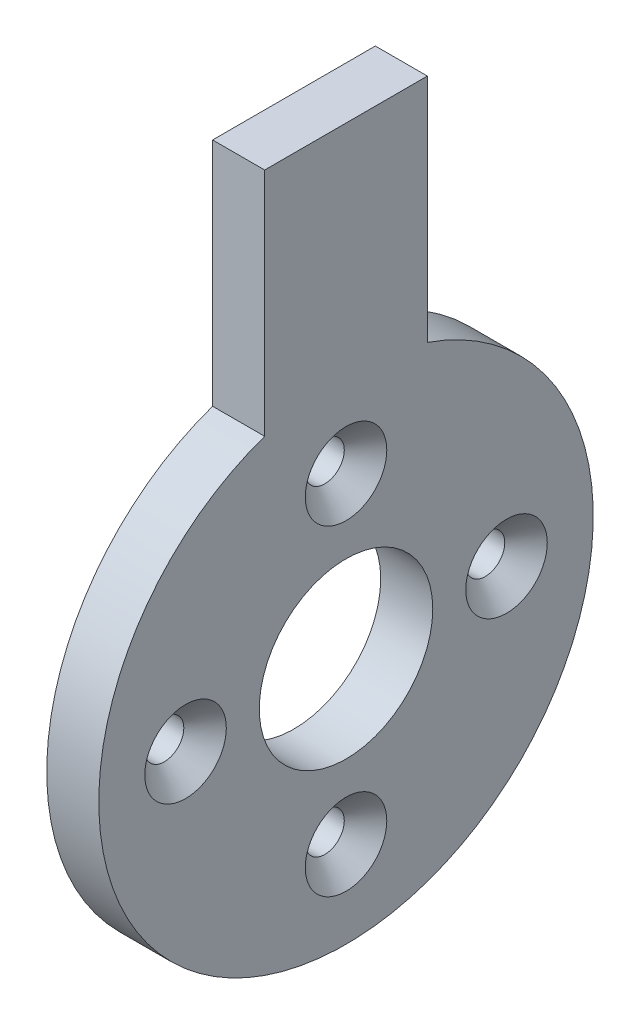
from build123d import *

# Parameters (mm, degrees)
SKETCH1_R                                       = 28.5
BOSS_EXTRUDE1_DEPTH                             = 3
SKETCH2_R                                       = 10
CUT_EXTRUDE1_DEPTH                              = 41.749233122
BOSS_EXTRUDE2_DEPTH                             = 3
CSK_FOR_M4_FLAT_HEAD_MACHINE_SCREW1_D           = 4.5
CSK_FOR_M4_FLAT_HEAD_MACHINE_SCREW1_CSINK_D     = 9.4
CSK_FOR_M4_FLAT_HEAD_MACHINE_SCREW1_CSINK_ANGLE = 90


with BuildPart() as part:
    # Sketch1 → Boss-Extrude1 (new, symmetric)
    with BuildSketch(Plane(origin=(0, 0, 0), x_dir=(0, 0, -1), z_dir=(1, 0, 0))):
        Circle(SKETCH1_R)
    extrude(amount=BOSS_EXTRUDE1_DEPTH, both=True)

    # Sketch2 → Cut-Extrude1 (cut, through all)
    with BuildSketch(Plane(origin=(3, 0, 0), x_dir=(0, 0, -1), z_dir=(1, 0, 0))):
        Circle(SKETCH2_R)
    extrude(amount=-CUT_EXTRUDE1_DEPTH, mode=Mode.SUBTRACT)

    # Sketch3 → Boss-Extrude2 (add, symmetric)
    with BuildSketch(Plane(origin=(0, 0, 0), x_dir=(0, 0, -1), z_dir=(1, 0, 0))):
        with BuildLine():
            Line((-9.379163336, 53.5), (-9.379163336, 26.912474712))
            ThreePointArc((-9.379163336, 26.912474712), (0, 28.5), (9.379163336, 26.912474712))
            Line((9.379163336, 26.912474712), (9.379163336, 53.5))
            Line((9.379163336, 53.5), (-9.379163336, 53.5))
        make_face()
    extrude(amount=BOSS_EXTRUDE2_DEPTH, both=True)

    # CSK for M4 Flat Head Machine Screw1 (through all)
    with Locations(Plane(origin=(3, 18.5, 0), x_dir=(0, 0, 1), z_dir=(1, 0, 0))):
        with Locations((0, 0), (-18.5, 18.5), (0, 37), (18.5, 18.5)):
            CounterSinkHole(CSK_FOR_M4_FLAT_HEAD_MACHINE_SCREW1_D / 2, CSK_FOR_M4_FLAT_HEAD_MACHINE_SCREW1_CSINK_D / 2, counter_sink_angle=CSK_FOR_M4_FLAT_HEAD_MACHINE_SCREW1_CSINK_ANGLE)


solid = part.part
